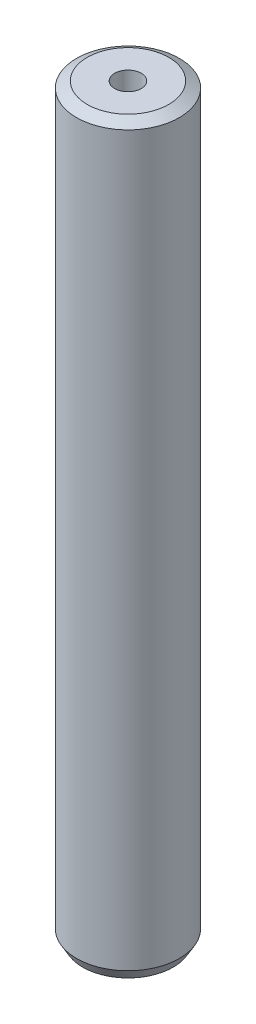
from build123d import *
from OCP.BRepFilletAPI import BRepFilletAPI_MakeChamfer

# Parameters (mm, degrees)
SKETCH1_R           = 12.5
BOSS_EXTRUDE1_DEPTH = 181.160194393
SKETCH2_R           = 3.233818979
CUT_EXTRUDE1_DEPTH  = 183.020647269
CHAMFER1_SIZE       = 1.488456448
CHAMFER1_SIZE2      = 2.578082194


with BuildPart() as part:
    # Sketch1 → Boss-Extrude1 (new body)
    with BuildSketch(Plane(origin=(0, 0, 0), x_dir=(1, 0, 0), z_dir=(0, 1, 0))):
        Circle(SKETCH1_R)
    extrude(amount=BOSS_EXTRUDE1_DEPTH)

    # Sketch2 → Cut-Extrude1 (cut, through all)
    with BuildSketch(Plane(origin=(0, 0, 0), x_dir=(1, 0, 0), z_dir=(0, 1, 0))):
        Circle(SKETCH2_R)
    extrude(amount=CUT_EXTRUDE1_DEPTH, mode=Mode.SUBTRACT)

    # Chamfer1: one chamfer whose edges measure the first distance from different faces: ONE call of the kernel's chamfer builder (chamfer() names one face for all edges)
    chamfer1_edges_1 = [part.edges().sort_by_distance(p)[0] for p in [
        (-12.5, 181.160194393, 0),
    ]]
    chamfer1_side_1 = [part.faces().sort_by_distance(p)[0] for p in [
        (-12.5, 90.580097196, 0),
    ]]
    chamfer1_edges_2 = [part.edges().sort_by_distance(p)[0] for p in [
        (-12.5, 0, 0),
    ]]
    chamfer1_side_2 = [part.faces().sort_by_distance(p)[0] for p in [
        (-12.146446609, 0, 0),
    ]]
    chamfer1 = BRepFilletAPI_MakeChamfer(part.part.solid().wrapped)
    for e in chamfer1_edges_1:
        chamfer1.Add(CHAMFER1_SIZE, CHAMFER1_SIZE2, e.wrapped, chamfer1_side_1[0].wrapped)  # the first distance lies on this face
    for e in chamfer1_edges_2:
        chamfer1.Add(CHAMFER1_SIZE, CHAMFER1_SIZE2, e.wrapped, chamfer1_side_2[0].wrapped)  # the first distance lies on this face
    add(Compound.cast(chamfer1.Shape()), mode=Mode.REPLACE)


solid = part.part
